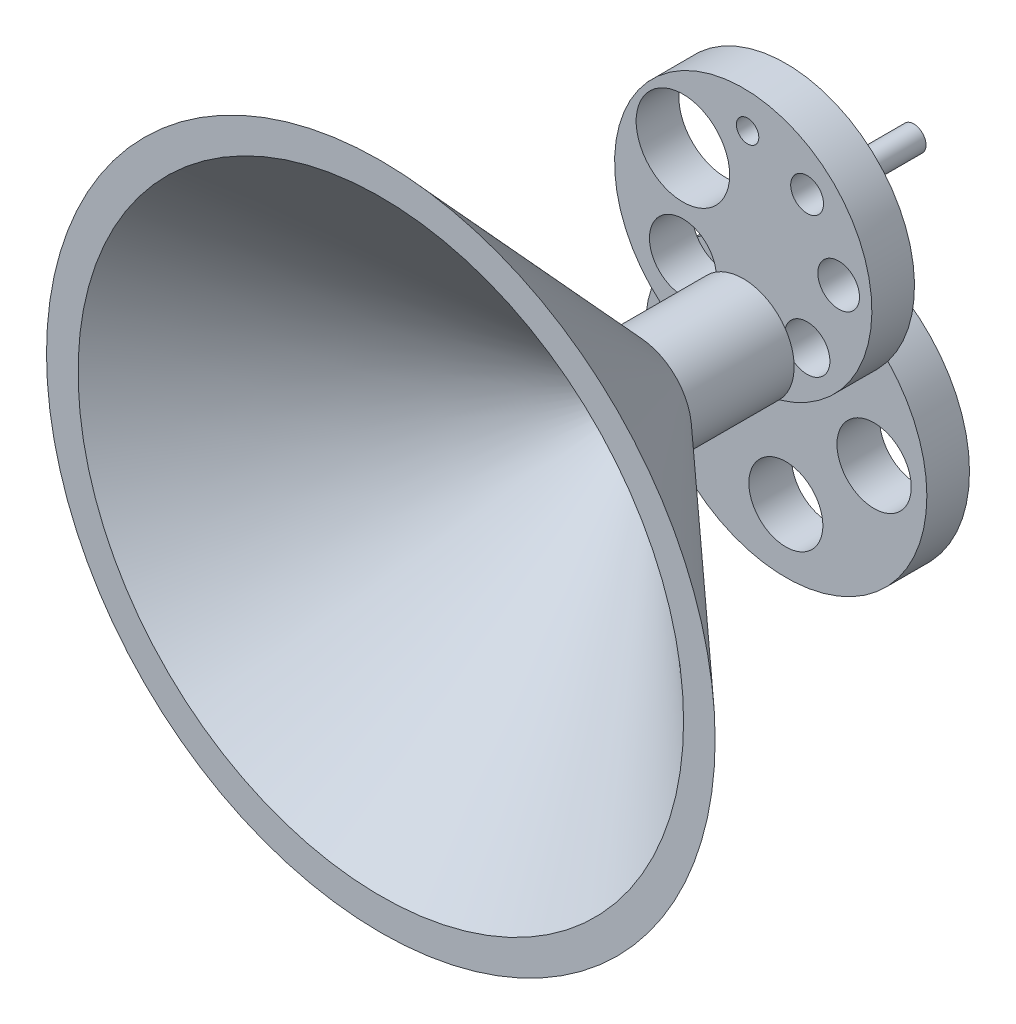
from build123d import *

# Parameters (mm, degrees)
SKETCH_1_R      = 60.353493774
SKETCH_1_R_2    = 5.249937669
SKETCH_1_R_3    = 7.709883183
SKETCH_1_R_4    = 9.776049215
SKETCH_1_R_5    = 10.682207241
SKETCH_1_R_6    = 12.535934249
SKETCH_1_R_7    = 15.691744865
SKETCH_1_R_8    = 21.933378779
EXTRUDE_1_DEPTH = 20
SKETCH_2_R      = 23.897110151
SKETCH_2_R_2    = 18.408818548
EXTRUDE_2_DEPTH = 50
SKETCH_5_R      = 5.758247264
EXTRUDE_3_DEPTH = 60
SKETCH_6_R      = 66.152888952
SKETCH_6_R_2    = 19.174469575
SKETCH_6_R_3    = 15.159489644
SKETCH_6_R_4    = 17.427329396
SKETCH_6_R_5    = 17.348205871
EXTRUDE_4_DEPTH = 20
SKETCH_7_R      = 7.266662744
EXTRUDE_5_DEPTH = 40


# Read off the part's stored shape, not the designer's step: 放样-薄件1
with BuildPart() as part:
    # 草图1 → 凸台-拉伸1 (new body)
    with BuildSketch(Plane.XY):
        Circle(SKETCH_1_R)
        with Locations((2.061161415, 43.884893492)):
            Circle(SKETCH_1_R_2, mode=Mode.SUBTRACT)
        with Locations((29.98052968, 32.080059931)):
            Circle(SKETCH_1_R_3, mode=Mode.SUBTRACT)
        with Locations((44.783416209, 2.661665183)):
            Circle(SKETCH_1_R_4, mode=Mode.SUBTRACT)
        with Locations((29.98052968, -30.316917465)):
            Circle(SKETCH_1_R_5, mode=Mode.SUBTRACT)
        with Locations((0, -40.999124706)):
            Circle(SKETCH_1_R_6, mode=Mode.SUBTRACT)
        with Locations((-28.294124885, -22.634406734)):
            Circle(SKETCH_1_R_7, mode=Mode.SUBTRACT)
        with Locations((-28.294124885, 21.774252854)):
            Circle(SKETCH_1_R_8, mode=Mode.SUBTRACT)
    extrude(amount=EXTRUDE_1_DEPTH)

    # 草图2 → 凸台-拉伸2 (add)
    with BuildSketch(Plane.XY.offset(20)):
        with Locations(Location((0, -40.999124706, 0), (0, 0, 171.88446927))):
            Circle(SKETCH_2_R)
        with Locations(Location((0, -40.999124706, 0), (0, 0, 154.797833564))):
            Circle(SKETCH_2_R_2, mode=Mode.SUBTRACT)
    extrude(amount=EXTRUDE_2_DEPTH)

    # 放样-薄件1 outline → 放样-薄件1 (revolve)
    with BuildSketch(Plane.XZ.offset(40.999124706)):
        Polygon((142.029499723, 190), (11.005834825, 70), (25.81180227, 70), (156.835467167, 190), align=None)
    revolve(axis=Axis((0, -40.999124706, 0), (0, 0, 1)))

    # 草图5 → 凸台-拉伸3 (add)
    with BuildSketch(Plane(origin=(0, 0, 0), x_dir=(-1, 0, 0), z_dir=(0, 0, -1))):
        with Locations(Location((0, 0, 0), (0, 0, 180))):
            Circle(SKETCH_5_R)
    extrude(amount=EXTRUDE_3_DEPTH)

    # 草图6 → 凸台-拉伸4 (add)
    with BuildSketch(Plane(origin=(0, 0, 0), x_dir=(-1, 0, 0), z_dir=(0, 0, -1))):
        with Locations(Location((0, -82.400396549, 0), (0, 0, 136.362104422))):
            Circle(SKETCH_6_R)
        with Locations(Location((0, -40.999124706, 0), (0, 0, 46.213976219))):
            Circle(SKETCH_6_R_2, mode=Mode.SUBTRACT)
        with Locations((45.85301636, -82.400396549)):
            Circle(SKETCH_6_R_3, mode=Mode.SUBTRACT)
        with Locations((-41.408908427, -82.400396549)):
            Circle(SKETCH_6_R_4, mode=Mode.SUBTRACT)
        with Locations((0, -118.765519068)):
            Circle(SKETCH_6_R_5, mode=Mode.SUBTRACT)
    extrude(amount=EXTRUDE_4_DEPTH)

    # 草图7 → 凸台-拉伸5 (add)
    with BuildSketch(Plane(origin=(0, 0, -20), x_dir=(-1, 0, 0), z_dir=(0, 0, -1))):
        with Locations((0, -82.400396549)):
            Circle(SKETCH_7_R)
    extrude(amount=EXTRUDE_5_DEPTH)


solid = part.part
